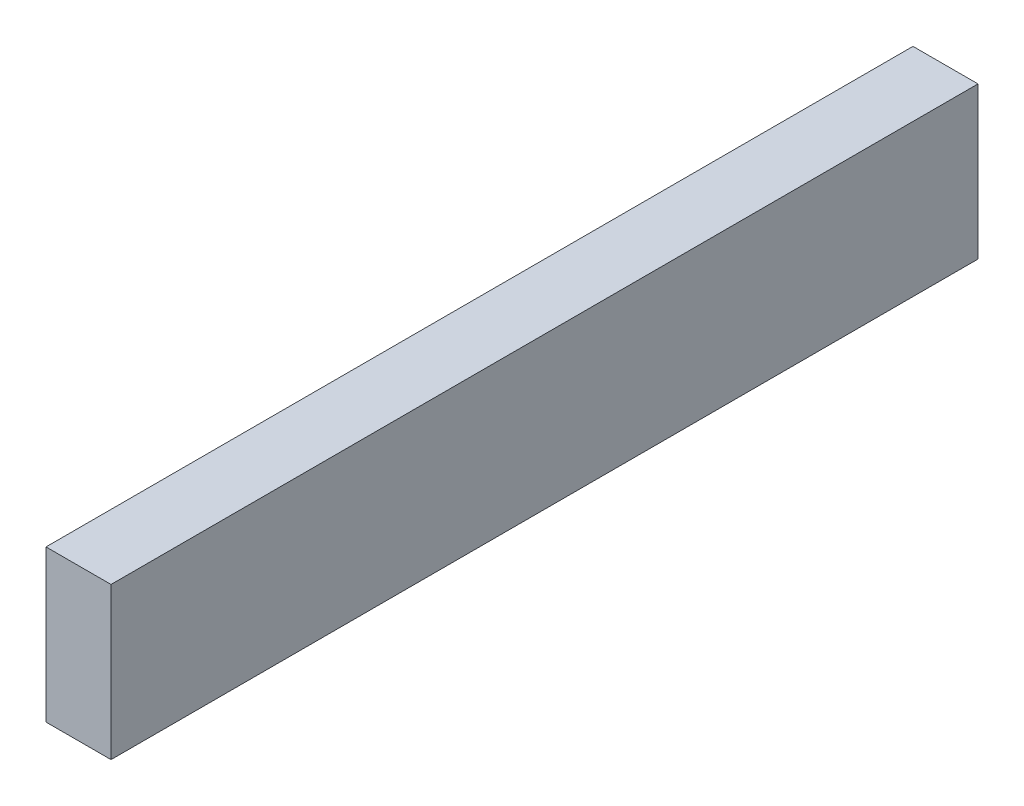
from build123d import *

# Parameters (mm, degrees)
SKETCH1_W           = 38.1
SKETCH1_H           = 88.9
BOSS_EXTRUDE1_DEPTH = 254


with BuildPart() as part:
    # Sketch1 → Boss-Extrude1 (new, symmetric)
    with BuildSketch(Plane.XY):
        Rectangle(SKETCH1_W, SKETCH1_H)
    extrude(amount=BOSS_EXTRUDE1_DEPTH, both=True)


solid = part.part
